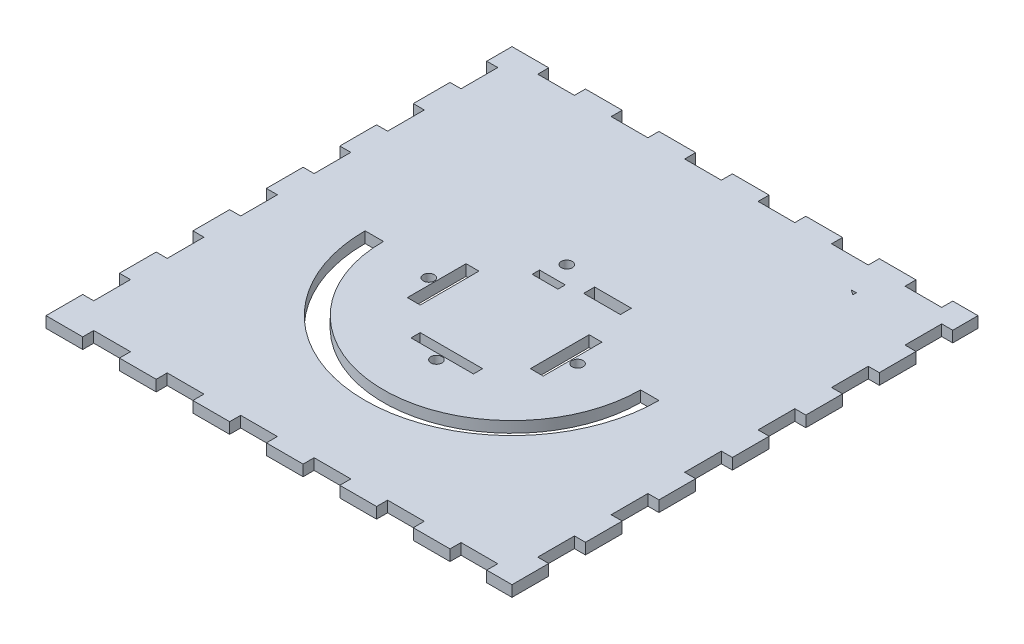
from build123d import *

# Parameters (mm, degrees)
SKETCH2_W           = 126.877068242
SKETCH2_H           = 126.877068242
BOSS_EXTRUDE1_DEPTH = 3
CUT_EXTRUDE1_DEPTH  = 10
CUT_EXTRUDE2_DEPTH  = 90.765779798
SKETCH5_R           = 1.5
SKETCH5_W           = 3.5
SKETCH5_H           = 16
SKETCH5_W_2         = 7
SKETCH5_H_2         = 2
SKETCH5_W_3         = 17
SKETCH5_H_3         = 2.5
SKETCH5_W_4         = 10
SKETCH5_H_4         = 3
CUT_EXTRUDE3_DEPTH  = 90.765779798
SKETCH6_W           = 3
SKETCH6_H           = 10
SKETCH6_W_2         = 10
SKETCH6_H_2         = 3
CUT_EXTRUDE4_DEPTH  = 90.765779798


with BuildPart() as part:
    # Sketch2 → Boss-Extrude1 (new body)
    with BuildSketch(Plane(origin=(0, 0, 0), x_dir=(1, 0, 0), z_dir=(0, 1, 0))):
        Rectangle(SKETCH2_W, SKETCH2_H)
    extrude(amount=BOSS_EXTRUDE1_DEPTH)

    # Sketch3 → Cut-Extrude1 (cut)
    with BuildSketch(Plane(origin=(0, 3, 0), x_dir=(1, 0, 0), z_dir=(0, 1, 0))):
        with BuildLine():
            Line((-40, 0), (-35, 0))
            ThreePointArc((-35, 0), (0, -35), (35, 0))
            Line((35, 0), (40, 0))
            ThreePointArc((40, 0), (0, -40), (-40, 0))
        make_face()
    extrude(amount=-CUT_EXTRUDE1_DEPTH, mode=Mode.SUBTRACT)

    # Sketch4 → Cut-Extrude2 (cut, through all)
    with BuildSketch(Plane(origin=(0, 3, 0), x_dir=(1, 0, 0), z_dir=(0, 1, 0))):
        Polygon((40.088078282, 52.270772828), (41.491674647, 51.305800327), (41.491674647, 52.270772828), align=None)
    extrude(amount=-CUT_EXTRUDE2_DEPTH, mode=Mode.SUBTRACT)

    # Sketch5 → Cut-Extrude3 (cut, through all)
    with BuildSketch(Plane(origin=(0, 3, 0), x_dir=(1, 0, 0), z_dir=(0, 1, 0))):
        with Locations((0.12809868, -20.7)):
            Circle(SKETCH5_R)
        with Locations((-4.581844526, 19.5)):
            Circle(SKETCH5_R)
        with Locations((-20.25, -2.401263976)):
            Circle(SKETCH5_R)
        with Locations((20.25, -2.401263976)):
            Circle(SKETCH5_R)
        with Locations((16.75, -2)):
            Rectangle(SKETCH5_W, SKETCH5_H)
        with Locations((-3.5, 13.5)):
            Rectangle(SKETCH5_W_2, SKETCH5_H_2)
        with Locations((0, -17.75)):
            Rectangle(SKETCH5_W_3, SKETCH5_H_3)
        with Locations((-16.75, -2)):
            Rectangle(SKETCH5_W, SKETCH5_H)
        with Locations((9.5, 16.5)):
            Rectangle(SKETCH5_W_4, SKETCH5_H_4)
    extrude(amount=-CUT_EXTRUDE3_DEPTH, mode=Mode.SUBTRACT)

    # Sketch6 → Cut-Extrude4 (cut, through all)
    with BuildSketch(Plane(origin=(0, 3, 0), x_dir=(1, 0, 0), z_dir=(0, 1, 0))):
        with Locations((-61.938534121, -48.438534121)):
            Rectangle(SKETCH6_W, SKETCH6_H)
        with Locations((-61.938534121, -28.438534121)):
            Rectangle(SKETCH6_W, SKETCH6_H)
        with Locations((-61.938534121, -8.438534121)):
            Rectangle(SKETCH6_W, SKETCH6_H)
        with Locations((-61.938534121, 11.561465879)):
            Rectangle(SKETCH6_W, SKETCH6_H)
        with Locations((-61.938534121, 31.561465879)):
            Rectangle(SKETCH6_W, SKETCH6_H)
        with Locations((-61.938534121, 51.561465879)):
            Rectangle(SKETCH6_W, SKETCH6_H)
        with Locations((61.938534121, 51.561465879)):
            Rectangle(SKETCH6_W, SKETCH6_H)
        with Locations((61.938534121, 31.561465879)):
            Rectangle(SKETCH6_W, SKETCH6_H)
        with Locations((61.938534121, 11.561465879)):
            Rectangle(SKETCH6_W, SKETCH6_H)
        with Locations((61.938534121, -8.438534121)):
            Rectangle(SKETCH6_W, SKETCH6_H)
        with Locations((61.938534121, -28.438534121)):
            Rectangle(SKETCH6_W, SKETCH6_H)
        with Locations((61.938534121, -48.438534121)):
            Rectangle(SKETCH6_W, SKETCH6_H)
        with Locations((-28.438534121, -61.938534121)):
            Rectangle(SKETCH6_W_2, SKETCH6_H_2)
        with Locations((-48.438534121, -61.938534121)):
            Rectangle(SKETCH6_W_2, SKETCH6_H_2)
        with Locations((-8.438534121, -61.938534121)):
            Rectangle(SKETCH6_W_2, SKETCH6_H_2)
        with Locations((11.561465879, -61.938534121)):
            Rectangle(SKETCH6_W_2, SKETCH6_H_2)
        with Locations((31.561465879, -61.938534121)):
            Rectangle(SKETCH6_W_2, SKETCH6_H_2)
        with Locations((51.561465879, -61.938534121)):
            Rectangle(SKETCH6_W_2, SKETCH6_H_2)
        with Locations((51.561465879, 61.938534121)):
            Rectangle(SKETCH6_W_2, SKETCH6_H_2)
        with Locations((31.561465879, 61.938534121)):
            Rectangle(SKETCH6_W_2, SKETCH6_H_2)
        with Locations((11.561465879, 61.938534121)):
            Rectangle(SKETCH6_W_2, SKETCH6_H_2)
        with Locations((-8.438534121, 61.938534121)):
            Rectangle(SKETCH6_W_2, SKETCH6_H_2)
        with Locations((-28.438534121, 61.938534121)):
            Rectangle(SKETCH6_W_2, SKETCH6_H_2)
        with Locations((-48.438534121, 61.938534121)):
            Rectangle(SKETCH6_W_2, SKETCH6_H_2)
    extrude(amount=-CUT_EXTRUDE4_DEPTH, mode=Mode.SUBTRACT)


solid = part.part
